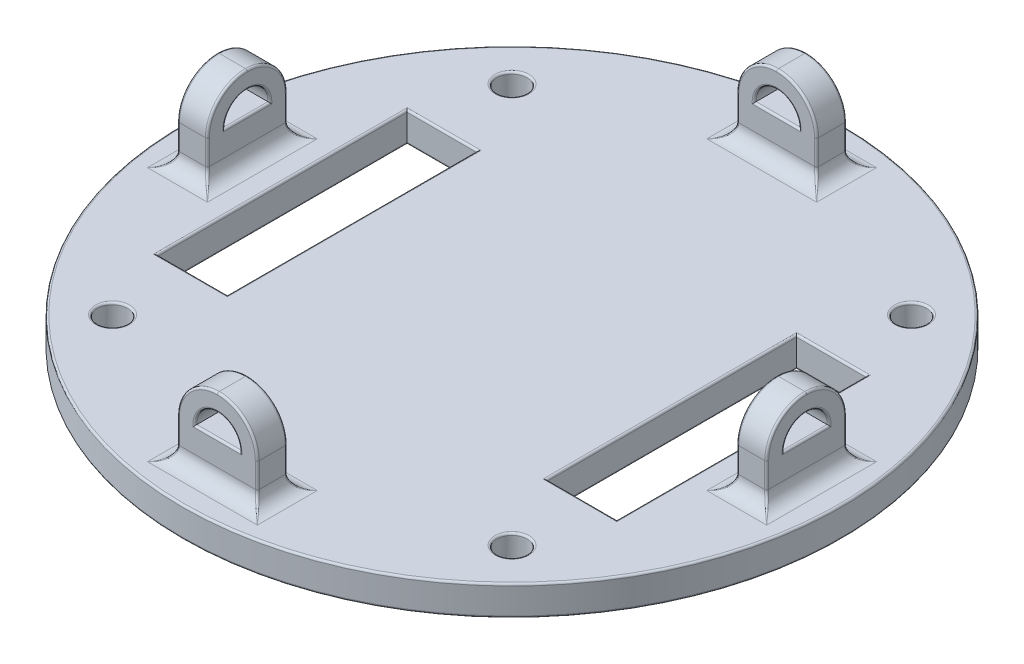
from build123d import *

# Parameters (mm, degrees)
SKETCH1_R                = 33
BOSS_EXTRUDE1_DEPTH      = 3
CUT_EXTRUDE1_REACH       = 48.765
SKETCH2_W                = 7
SKETCH2_H                = 25
CUT_EXTRUDE2_REACH       = 48.765
SKETCH3_R                = 1.5
SKETCH4_W                = 8
SKETCH4_H                = 3
BOSS_EXTRUDE2_DEPTH      = 8
CUT_EXTRUDE3_REACH       = 70.922
FILLET1_R                = 4
FILLET2_R                = 1.5
FILLET5_R                = 0.2
CIRPATTERN1_COUNT        = 4
FILLET1_OF_CIRPATTERN1_R = 4
FILLET2_OF_CIRPATTERN1_R = 1.5
FILLET5_OF_CIRPATTERN1_R = 0.2
FILLET4_R                = 0.2


with BuildPart() as part:
    # Sketch1 → Boss-Extrude1 (new body)
    with BuildSketch(Plane(origin=(0, 0, 0), x_dir=(1, 0, 0), z_dir=(0, 1, 0))):
        with Locations(Location((0, 0, 0), (0, 0, 270))):
            Circle(SKETCH1_R)
    extrude(amount=BOSS_EXTRUDE1_DEPTH)

    # Sketch2 → Cut-Extrude1 (cut, up to next)
    with BuildSketch(Plane(origin=(0, 3, 0), x_dir=(1, 0, 0), z_dir=(0, 1, 0)), mode=Mode.PRIVATE) as cut_extrude1_sk1:
        with Locations((-19.5, 0)):
            Rectangle(SKETCH2_W, SKETCH2_H)
    cut_extrude1_tool1 = extrude(cut_extrude1_sk1.sketch, amount=-CUT_EXTRUDE1_REACH, mode=Mode.PRIVATE) & part.part
    # Sketch2 → Cut-Extrude1 (cut, up to next)
    with BuildSketch(Plane(origin=(0, 3, 0), x_dir=(1, 0, 0), z_dir=(0, 1, 0)), mode=Mode.PRIVATE) as cut_extrude1_sk2:
        with Locations((19.5, 0)):
            Rectangle(SKETCH2_W, SKETCH2_H)
    cut_extrude1_tool2 = extrude(cut_extrude1_sk2.sketch, amount=-CUT_EXTRUDE1_REACH, mode=Mode.PRIVATE) & part.part
    add(cut_extrude1_tool1.solids().sort_by_distance((-19.5, 3, 0))[0], mode=Mode.SUBTRACT)
    add(cut_extrude1_tool2.solids().sort_by_distance((19.5, 3, 0))[0], mode=Mode.SUBTRACT)

    # Sketch3 → Cut-Extrude2 (cut, up to next)
    with BuildSketch(Plane(origin=(0, 3, 0), x_dir=(1, 0, 0), z_dir=(0, 1, 0)), mode=Mode.PRIVATE) as cut_extrude2_sk1:
        with Locations(Location((-20, -20, 0), (0, 0, 270))):
            Circle(SKETCH3_R)
    cut_extrude2_tool1 = extrude(cut_extrude2_sk1.sketch, amount=-CUT_EXTRUDE2_REACH, mode=Mode.PRIVATE) & part.part
    # Sketch3 → Cut-Extrude2 (cut, up to next)
    with BuildSketch(Plane(origin=(0, 3, 0), x_dir=(1, 0, 0), z_dir=(0, 1, 0)), mode=Mode.PRIVATE) as cut_extrude2_sk2:
        with Locations(Location((20, -20, 0), (0, 0, 270))):
            Circle(SKETCH3_R)
    cut_extrude2_tool2 = extrude(cut_extrude2_sk2.sketch, amount=-CUT_EXTRUDE2_REACH, mode=Mode.PRIVATE) & part.part
    # Sketch3 → Cut-Extrude2 (cut, up to next)
    with BuildSketch(Plane(origin=(0, 3, 0), x_dir=(1, 0, 0), z_dir=(0, 1, 0)), mode=Mode.PRIVATE) as cut_extrude2_sk3:
        with Locations(Location((20, 20, 0), (0, 0, 270))):
            Circle(SKETCH3_R)
    cut_extrude2_tool3 = extrude(cut_extrude2_sk3.sketch, amount=-CUT_EXTRUDE2_REACH, mode=Mode.PRIVATE) & part.part
    # Sketch3 → Cut-Extrude2 (cut, up to next)
    with BuildSketch(Plane(origin=(0, 3, 0), x_dir=(1, 0, 0), z_dir=(0, 1, 0)), mode=Mode.PRIVATE) as cut_extrude2_sk4:
        with Locations(Location((-20, 20, 0), (0, 0, 270))):
            Circle(SKETCH3_R)
    cut_extrude2_tool4 = extrude(cut_extrude2_sk4.sketch, amount=-CUT_EXTRUDE2_REACH, mode=Mode.PRIVATE) & part.part
    add(cut_extrude2_tool1.solids().sort_by_distance((-20, 3, 20))[0], mode=Mode.SUBTRACT)
    add(cut_extrude2_tool2.solids().sort_by_distance((20, 3, 20))[0], mode=Mode.SUBTRACT)
    add(cut_extrude2_tool3.solids().sort_by_distance((20, 3, -20))[0], mode=Mode.SUBTRACT)
    add(cut_extrude2_tool4.solids().sort_by_distance((-20, 3, -20))[0], mode=Mode.SUBTRACT)

    # Sketch4 → Boss-Extrude2 (add)
    with BuildSketch(Plane(origin=(0, 3, 0), x_dir=(1, 0, 0), z_dir=(0, 1, 0))):
        with Locations((0, 28)):
            Rectangle(SKETCH4_W, SKETCH4_H)
    boss_extrude2 = extrude(amount=BOSS_EXTRUDE2_DEPTH)

    # Sketch5 → Cut-Extrude3 (cut, up to next)
    with BuildSketch(Plane.XY.offset(-26.5), mode=Mode.PRIVATE) as cut_extrude3_sk1:
        with BuildLine():
            Line((-2.25, 7), (2.25, 7))
            ThreePointArc((2.25, 7), (0, 9.25), (-2.25, 7))
        make_face()
    cut_extrude3_tool1 = extrude(cut_extrude3_sk1.sketch, amount=-CUT_EXTRUDE3_REACH, mode=Mode.PRIVATE) & part.part
    cut_extrude3 = cut_extrude3_tool1.solids().sort_by_distance((0, 7.95493, -26.5))[0]
    add(cut_extrude3, mode=Mode.SUBTRACT)

    # Fillet1
    fillet1_edges = [part.edges().sort_by_distance(p)[0] for p in [
        (-4, 11, -28),
        (4, 11, -28),
    ]]
    fillet(fillet1_edges, radius=FILLET1_R - 0.0001)  # a hair under: the kernel refuses the full size

    # Fillet2
    fillet2_edges = [part.edges().sort_by_distance(p)[0] for p in [
        (4, 3, -28),
        (0, 3, -29.5),
        (-4, 3, -28),
        (0, 3, -26.5),
    ]]
    fillet(fillet2_edges, radius=FILLET2_R)

    # Fillet5
    fillet5_edges = [part.edges().sort_by_distance(p)[0] for p in [
        (0, 9.25, -26.5),
        (0, 7, -26.5),
        (0, 7, -29.5),
        (0, 9.25, -29.5),
        (4, 5.75005, -26.5),
        (-4, 5.75005, -26.5),
        (2.828456414, 9.828456414, -26.5),
        (-2.828456414, 9.828456414, -26.5),
        (-4, 5.75005, -29.5),
        (4, 5.75005, -29.5),
        (2.828456414, 9.828456414, -29.5),
        (-2.828456414, 9.828456414, -29.5),
        (4.530926639, 3.355055975, -25.969073361),
        (-4.530926639, 3.355055975, -25.969073361),
        (4.530926639, 3.355055975, -30.030926639),
        (-4.530926639, 3.355055975, -30.030926639),
    ]]
    fillet(fillet5_edges, radius=FILLET5_R)

    # CirPattern1: Boss-Extrude2, Cut-Extrude3 ×4 about axis
    cirpattern1_axis = Axis((0, 3, 0), (0, 1, 0))
    add([boss_extrude2.rotate(cirpattern1_axis, i * 360 / CIRPATTERN1_COUNT) for i in range(1, CIRPATTERN1_COUNT)])
    add([cut_extrude3.rotate(cirpattern1_axis, i * 360 / CIRPATTERN1_COUNT) for i in range(1, CIRPATTERN1_COUNT)], mode=Mode.SUBTRACT)

    # Fillet1 of CirPattern1
    fillet1_of_cirpattern1_edges = [part.edges().sort_by_distance(p)[0] for p in [
        (-28, 11, 4),
        (-28, 11, -4),
        (4, 11, 28),
        (-4, 11, 28),
        (28, 11, -4),
        (28, 11, 4),
    ]]
    fillet(fillet1_of_cirpattern1_edges, radius=FILLET1_OF_CIRPATTERN1_R - 0.0001)  # a hair under: the kernel refuses the full size

    # Fillet2 of CirPattern1
    fillet2_of_cirpattern1_edges = [part.edges().sort_by_distance(p)[0] for p in [
        (-28, 3, -4),
        (-29.5, 3, 0),
        (-28, 3, 4),
        (-26.5, 3, 0),
        (-4, 3, 28),
        (0, 3, 29.5),
        (4, 3, 28),
        (0, 3, 26.5),
        (28, 3, 4),
        (29.5, 3, 0),
        (28, 3, -4),
        (26.5, 3, 0),
    ]]
    fillet(fillet2_of_cirpattern1_edges, radius=FILLET2_OF_CIRPATTERN1_R)

    # Fillet5 of CirPattern1
    fillet5_of_cirpattern1_edges = [part.edges().sort_by_distance(p)[0] for p in [
        (-26.5, 9.25, 0),
        (-26.5, 7, 0),
        (-29.5, 7, 0),
        (-29.5, 9.25, 0),
        (-26.5, 5.75005, -4),
        (-26.5, 5.75005, 4),
        (-26.5, 9.828456414, -2.828456414),
        (-26.5, 9.828456414, 2.828456414),
        (-29.5, 5.75005, 4),
        (-29.5, 5.75005, -4),
        (-29.5, 9.828456414, -2.828456414),
        (-29.5, 9.828456414, 2.828456414),
        (-25.969073361, 3.355055975, -4.530926639),
        (-25.969073361, 3.355055975, 4.530926639),
        (-30.030926639, 3.355055975, -4.530926639),
        (-30.030926639, 3.355055975, 4.530926639),
        (0, 9.25, 26.5),
        (0, 7, 26.5),
        (0, 7, 29.5),
        (0, 9.25, 29.5),
        (-4, 5.75005, 26.5),
        (4, 5.75005, 26.5),
        (-2.828456414, 9.828456414, 26.5),
        (2.828456414, 9.828456414, 26.5),
        (4, 5.75005, 29.5),
        (-4, 5.75005, 29.5),
        (-2.828456414, 9.828456414, 29.5),
        (2.828456414, 9.828456414, 29.5),
        (-4.530926639, 3.355055975, 25.969073361),
        (4.530926639, 3.355055975, 25.969073361),
        (-4.530926639, 3.355055975, 30.030926639),
        (4.530926639, 3.355055975, 30.030926639),
        (26.5, 9.25, 0),
        (26.5, 7, 0),
        (29.5, 7, 0),
        (29.5, 9.25, 0),
        (26.5, 5.75005, 4),
        (26.5, 5.75005, -4),
        (26.5, 9.828456414, 2.828456414),
        (26.5, 9.828456414, -2.828456414),
        (29.5, 5.75005, -4),
        (29.5, 5.75005, 4),
        (29.5, 9.828456414, 2.828456414),
        (29.5, 9.828456414, -2.828456414),
        (25.969073361, 3.355055975, 4.530926639),
        (25.969073361, 3.355055975, -4.530926639),
        (30.030926639, 3.355055975, 4.530926639),
        (30.030926639, 3.355055975, -4.530926639),
    ]]
    fillet(fillet5_of_cirpattern1_edges, radius=FILLET5_OF_CIRPATTERN1_R)

    # Fillet4
    fillet4_edges = [part.edges().sort_by_distance(p)[0] for p in [
        (-23, 3, 0),
        (-19.5, 3, 12.5),
        (-16, 3, 0),
        (-19.5, 3, -12.5),
        (-19.5, 0, 12.5),
        (-23, 0, 0),
        (-19.5, 0, -12.5),
        (-16, 0, 0),
        (0, 0, -33),
        (19.5, 3, -12.5),
        (16, 3, 0),
        (19.5, 3, 12.5),
        (23, 3, 0),
        (16, 0, 0),
        (19.5, 0, -12.5),
        (23, 0, 0),
        (19.5, 0, 12.5),
        (-20, 3, -21.5),
        (-20, 0, -21.5),
        (20, 3, -21.5),
        (20, 0, -21.5),
        (20, 3, 18.5),
        (20, 0, 18.5),
        (-20, 3, 18.5),
        (-20, 0, 18.5),
        (0, 3, -33),
    ]]
    fillet(fillet4_edges, radius=FILLET4_R)


solid = part.part
